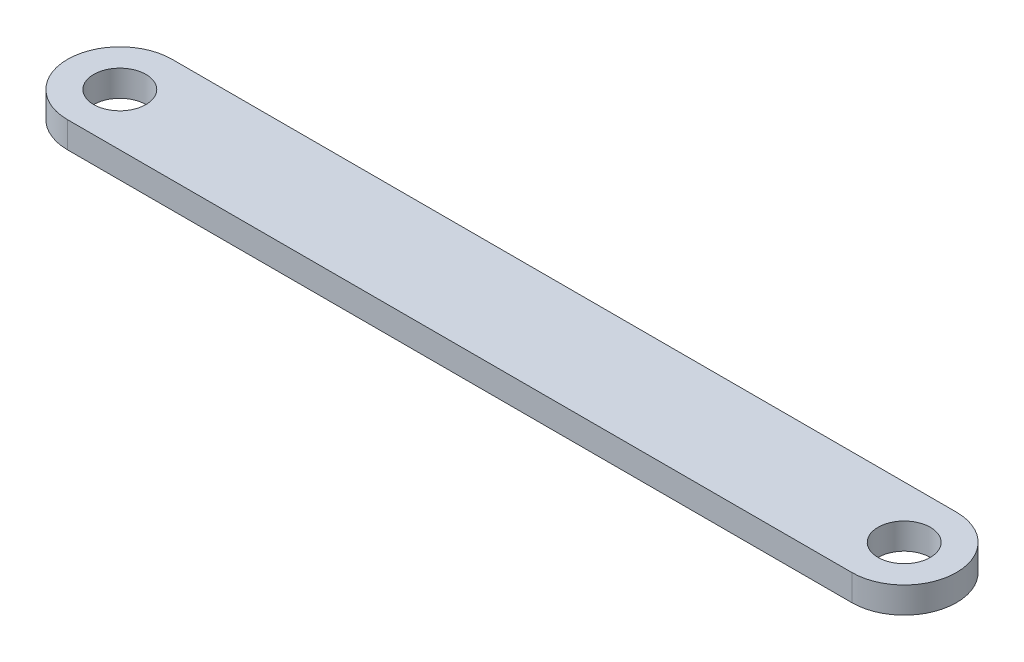
from build123d import *

# Parameters (mm, degrees)
SKETCH1_R           = 5
BOSS_EXTRUDE1_DEPTH = 5


with BuildPart() as part:
    # Sketch1 → Boss-Extrude1 (new body)
    with BuildSketch(Plane(origin=(0, 0, 0), x_dir=(1, 0, 0), z_dir=(0, 1, 0))):
        with BuildLine():
            Line((-75, 10), (75, 10))
            ThreePointArc((75, 10), (85, 0), (75, -10))
            Line((75, -10), (-75, -10))
            ThreePointArc((-75, -10), (-85, 0), (-75, 10))
        make_face()
        with Locations((-75, 0)):
            Circle(SKETCH1_R, mode=Mode.SUBTRACT)
        with Locations((75, 0)):
            Circle(SKETCH1_R, mode=Mode.SUBTRACT)
    extrude(amount=BOSS_EXTRUDE1_DEPTH)


solid = part.part
